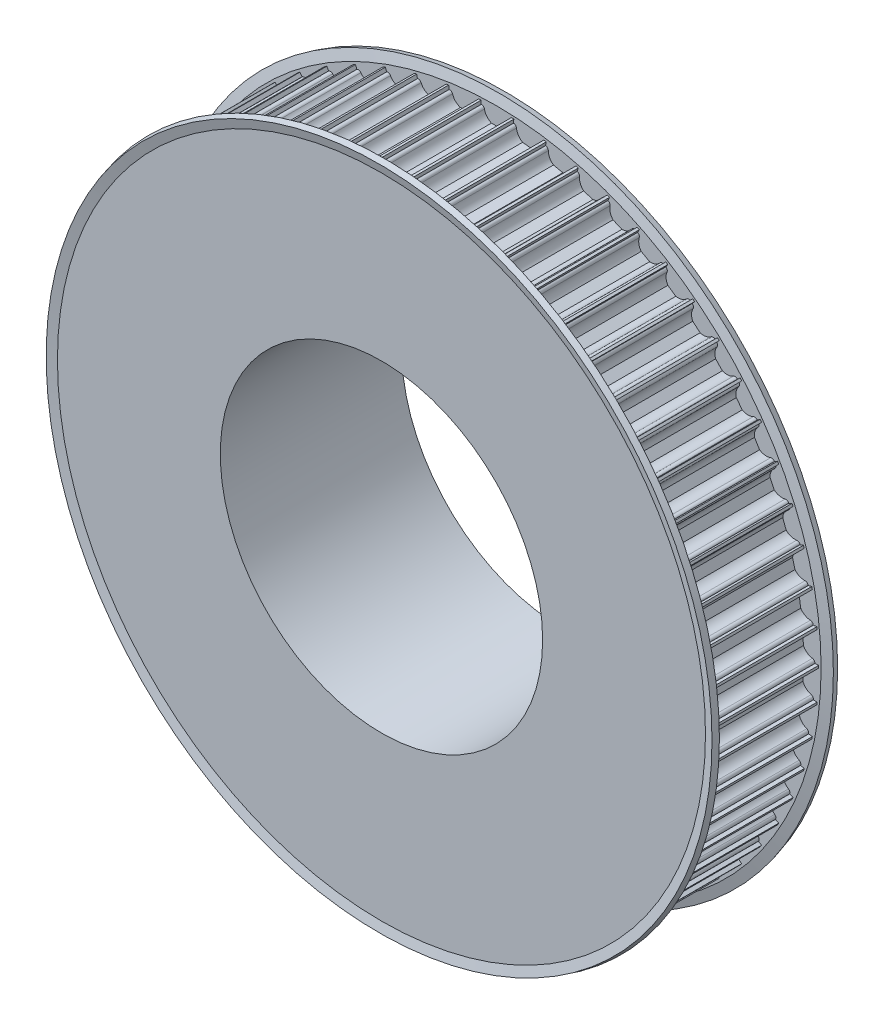
from build123d import *

# Parameters (mm, degrees)
CUT_EXTRUDE1_DEPTH = 122.757956619
CIRPATTERN1_COUNT  = 62


with BuildPart() as part:
    # Sketch1 → Revolve1 (revolve)
    with BuildSketch(Plane(origin=(0, 0, 0), x_dir=(0, 0, -1), z_dir=(1, 0, 0))):
        Polygon((0, 40), (0, 80), (30, 80), (30, 55.5), (45, 55.5), (45, 40), align=None)
    revolve(axis=Axis((0, 0, 101.727310717), (0, 0, -1)))

    # Sketch2 → Cut-Extrude1 (cut, through all)
    with BuildSketch(Plane.XY):
        with BuildLine():
            Line((3.674234614, 79), (3.75, 79))
            Line((3.75, 79), (3.75, 81))
            Line((3.75, 81), (-3.75, 81))
            Line((-3.75, 81), (-3.75, 79))
            Line((-3.75, 79), (-3.674234614, 79))
            ThreePointArc((-3.674234614, 79), (-3.199892965, 78.830947502), (-2.939387691, 78.4))
            ThreePointArc((-2.939387691, 78.4), (-2.331759211, 77.112435701), (-1.198957881, 76.25))
            Line((-1.198957881, 76.25), (1.198957881, 76.25))
            ThreePointArc((1.198957881, 76.25), (2.331759211, 77.112435701), (2.939387691, 78.4))
            ThreePointArc((2.939387691, 78.4), (3.199892965, 78.830947502), (3.674234614, 79))
        make_face()
    cut_extrude1 = extrude(amount=-CUT_EXTRUDE1_DEPTH, mode=Mode.SUBTRACT)

    # CirPattern1: Cut-Extrude1 ×62 about axis
    cirpattern1_axis = Axis((0, 0, 101.727310717), (0, 0, -1))
    for i in range(1, CIRPATTERN1_COUNT):
        add(cut_extrude1.rotate(cirpattern1_axis, i * 360 / CIRPATTERN1_COUNT), mode=Mode.SUBTRACT)

    # Sketch3 → Revolve2 (revolve)
    with BuildSketch(Plane(origin=(0, 0, 0), x_dir=(0, 0, -1), z_dir=(1, 0, 0))):
        Polygon((-0.591966801, 82.623832474), (0, 80.414582296), (0, 75.612061042), (1.5, 75.612061042), (1.5, 80.612061042), (0.856921938, 83.012061042), align=None)
    revolve(axis=Axis((0, 0, 101.727310717), (0, 0, -1)))

    # Sketch3<4> → Revolve3 (revolve)
    with BuildSketch(Plane(origin=(0, 0, 0), x_dir=(0, 0, -1), z_dir=(1, 0, 0))):
        Polygon((30.591966801, 82.623832474), (29.143078062, 83.012061042), (28.5, 80.612061042), (28.5, 75.612061042), (30, 75.612061042), (30, 80.414582296), align=None)
    revolve(axis=Axis((0, 0, 101.727310717), (0, 0, -1)))


solid = part.part
